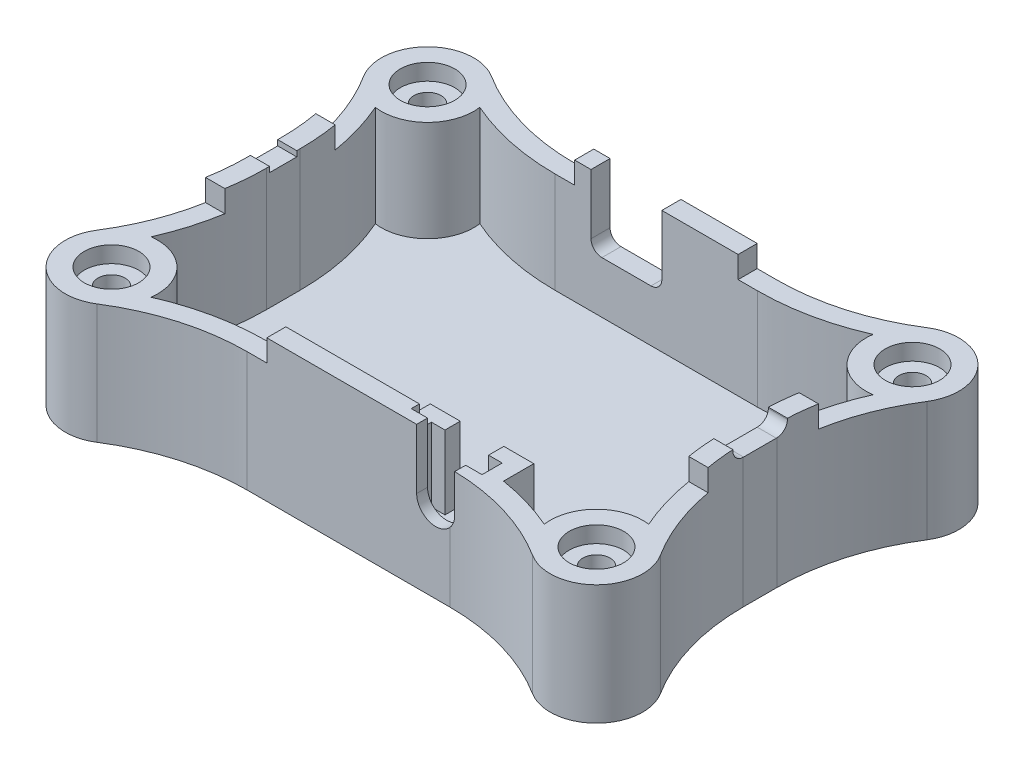
from build123d import *
from build123d.topology import SkipClean

# Parameters (mm, degrees)
SKETCH1_W                = 83
SKETCH1_H                = 52
SKETCH1_R                = 1.6
BOSS_EXTRUDE1_DEPTH      = 1.8
BOSS_EXTRUDE2_DEPTH      = 22
BOSS_EXTRUDE2_DEPTH_BACK = 15
SKETCH2_W                = 91
SKETCH2_H                = 60
SKETCH3_R                = 8.5
BOSS_EXTRUDE3_DEPTH      = 37
FILLET3_R                = 40
SHELL1_START             = -18.5
SHELL1_DEPTH             = 30
BOSS_EXTRUDE5_REACH      = 76.728
SKETCH5_R                = 5.25
CUT_EXTRUDE1_DEPTH       = 3.5
SKETCH6_R                = 2.5
CUT_EXTRUDE2_DEPTH       = 74.058195981
SPLIT1_SURFACE_1_BACK    = 136.019
SPLIT1_SURFACE_1_DEPTH   = 272.038
SPLIT1_SURFACE_2_BACK    = 136.019
SPLIT1_SURFACE_2_DEPTH   = 272.038
BOSS_EXTRUDE6_REACH      = 70.551
SKETCH8_R                = 8.5
SKETCH8_R_2              = 2.5
SKETCH9_W                = 30
SKETCH9_H                = 3.5
BOSS_EXTRUDE7_DEPTH      = 4
SKETCH11_R               = 8.5
SKETCH11_R_2             = 2.5
BOSS_EXTRUDE8_DEPTH      = 13.2
SKETCH12_W               = 30.4
SKETCH12_H               = 3.9
CUT_EXTRUDE4_DEPTH       = 4.2
SKETCH13_R               = 2.6
CUT_EXTRUDE5_DEPTH       = 10
SKETCH14_R               = 4.6
SKETCH14_R_2             = 2.6
EXTRUDE_THIN1_DEPTH      = 3.5
SKETCH15_R               = 5.5
CUT_EXTRUDE6_DEPTH       = 4
SKETCH16_R               = 2.5
BOSS_EXTRUDE9_DEPTH      = 2
BOSS_EXTRUDE10_START     = -18.5
SKETCH17_R               = 8.5
SKETCH17_R_2             = 1.75
BOSS_EXTRUDE10_DEPTH     = 12.5
SKETCH18_R               = 5
CUT_EXTRUDE7_DEPTH       = 3
SKETCH19_R               = 2.5
BOSS_EXTRUDE11_DEPTH     = 2.5
CUT_EXTRUDE8_DEPTH       = 10
SKETCH22_W               = 12.4
SKETCH22_H               = 7.750475245
BOSS_EXTRUDE12_DEPTH     = 3.5
CUT_EXTRUDE9_DEPTH       = 10
CUT_EXTRUDE9_DEPTH_BACK  = 10
CUT_EXTRUDE10_DEPTH      = 10
CUT_EXTRUDE10_DEPTH_BACK = 10
SKETCH26_W               = 5
SKETCH26_H               = 8
CUT_EXTRUDE11_DEPTH      = 10
BOSS_EXTRUDE15_REACH     = 70.551
CUT_EXTRUDE14_DEPTH      = 10
CUT_EXTRUDE14_DEPTH_BACK = 10
BOSS_EXTRUDE16_START     = -5
SKETCH34_W               = 19
SKETCH34_H               = 5
BOSS_EXTRUDE16_DEPTH     = 5
BOSS_EXTRUDE17_DEPTH     = 3.5
CUT_EXTRUDE15_DEPTH      = 1.5
MOVE_FACE1_BY            = 1.3
MOVE_FACE1_2_BY          = 1.3
SKETCH37_W               = 4
SKETCH37_H               = 12
SKETCH37_R               = 1
SKETCH37_H_2             = 15
BOSS_EXTRUDE18_DEPTH     = 5
MOVE_FACE2_BY            = 3
SKETCH38_W               = 8
SKETCH38_H               = 12
BOSS_EXTRUDE19_DEPTH     = 2
MOVE_FACE3_BY            = 0.3
MOVE_FACE3_2_BY          = 0.3
MOVE_FACE3_3_BY          = 0.3
MOVE_FACE3_4_BY          = 0.3
MOVE_FACE3_5_BY          = 0.3
MOVE_FACE3_6_BY          = 0.3
MOVE_FACE3_7_BY          = 0.3
MOVE_FACE3_8_BY          = 0.3
MOVE_FACE3_9_BY          = 0.3
MOVE_FACE3_10_BY         = 0.3
SKETCH39_R               = 1
CUT_EXTRUDE16_DEPTH      = 78.325610301


# Read off the part's stored shape, not the designer's step: Shell1
with BuildPart() as part:
    # Sketch1 → Boss-Extrude1 (new body)
    with BuildSketch(Plane(origin=(0, 0, 0), x_dir=(1, 0, 0), z_dir=(0, 1, 0))):
        Rectangle(SKETCH1_W, SKETCH1_H)
        with Locations(Location((-38.5, 23, 0), (0, 0, 270))):
            Circle(SKETCH1_R, mode=Mode.SUBTRACT)
        with Locations(Location((-38.5, -23, 0), (0, 0, 270))):
            Circle(SKETCH1_R, mode=Mode.SUBTRACT)
        with Locations(Location((38.5, -23, 0), (0, 0, 270))):
            Circle(SKETCH1_R, mode=Mode.SUBTRACT)
        with Locations(Location((38.5, 23, 0), (0, 0, 270))):
            Circle(SKETCH1_R, mode=Mode.SUBTRACT)
    extrude(amount=BOSS_EXTRUDE1_DEPTH)


with BuildPart() as body_2:
    # Sketch2 → Boss-Extrude2 (new, two sides: drawn at the far end of the back side and taken through both)
    with BuildSketch(Plane.XZ.offset(-BOSS_EXTRUDE2_DEPTH_BACK)):
        Rectangle(SKETCH2_W, SKETCH2_H)
    extrude(amount=BOSS_EXTRUDE2_DEPTH + BOSS_EXTRUDE2_DEPTH_BACK)

    # Sketch3 → Boss-Extrude3 (add, through all)
    with BuildSketch(Plane.XZ.offset(22)):
        with Locations((-44.5, 29)):
            Circle(SKETCH3_R)
        with Locations((-44.5, -29)):
            Circle(SKETCH3_R)
        with Locations((44.5, -29)):
            Circle(SKETCH3_R)
        with Locations((44.5, 29)):
            Circle(SKETCH3_R)
    extrude(amount=-BOSS_EXTRUDE3_DEPTH)

    # Fillet3
    fillet3_edges = [body_2.edges().sort_by_distance(p)[0] for p in [
        (36.059028492, -3.5, 30),
        (45.5, -3.5, 20.559028492),
        (45.5, -3.5, -20.559028492),
        (36.059028492, -3.5, -30),
        (-45.5, -3.5, -20.559028492),
        (-36.059028492, -3.5, -30),
        (-45.5, -3.5, 20.559028492),
        (-36.059028492, -3.5, 30),
    ]]
    fillet(fillet3_edges, radius=FILLET3_R)

    # Shell1 outline → Shell1 (cut)
    with BuildSketch(Plane(origin=(0, 0, 0), x_dir=(1, 0, 0), z_dir=(0, 1, 0)).offset(SHELL1_START)):
        with BuildLine():
            ThreePointArc((-48.726804124, 26.329021359), (-43.715529077, 15.187291147), (-42, 3.091507184))
            Line((-42, 3.091507184), (-42, -3.091507184))
            ThreePointArc((-42, -3.091507184), (-43.715529077, -15.187291147), (-48.726804124, -26.329021359))
            ThreePointArc((-48.726804124, -26.329021359), (-48.035533906, -32.535533906), (-41.829021359, -33.226804124))
            ThreePointArc((-41.829021359, -33.226804124), (-30.687291147, -28.215529077), (-18.591507184, -26.5))
            Line((-18.591507184, -26.5), (18.591507184, -26.5))
            ThreePointArc((18.591507184, -26.5), (30.687291147, -28.215529077), (41.829021359, -33.226804124))
            ThreePointArc((41.829021359, -33.226804124), (48.035533906, -32.535533906), (48.726804124, -26.329021359))
            ThreePointArc((48.726804124, -26.329021359), (43.715529077, -15.187291147), (42, -3.091507184))
            Line((42, -3.091507184), (42, 3.091507184))
            ThreePointArc((42, 3.091507184), (43.715529077, 15.187291147), (48.726804124, 26.329021359))
            ThreePointArc((48.726804124, 26.329021359), (48.035533906, 32.535533906), (41.829021359, 33.226804124))
            ThreePointArc((41.829021359, 33.226804124), (30.687291147, 28.215529077), (18.591507184, 26.5))
            Line((18.591507184, 26.5), (-18.591507184, 26.5))
            ThreePointArc((-18.591507184, 26.5), (-30.687291147, 28.215529077), (-41.829021359, 33.226804124))
            ThreePointArc((-41.829021359, 33.226804124), (-48.035533906, 32.535533906), (-48.726804124, 26.329021359))
        make_face()
    extrude(amount=SHELL1_DEPTH, mode=Mode.SUBTRACT)

    # Sketch4 → Boss-Extrude5 (add, up to next)
    with BuildSketch(Plane.XZ.offset(22), mode=Mode.PRIVATE) as boss_extrude5_sk1:
        with BuildLine():
            Line((-42, 26.5), (-38.5, 26.5))
            ThreePointArc((-38.5, 26.5), (-38.001095149, 28.880686376), (-38.41227904, 31.278081104))
            ThreePointArc((-38.41227904, 31.278081104), (-40.142687647, 32.213803834), (-41.829021359, 33.226804124))
            ThreePointArc((-41.829021359, 33.226804124), (-48.035533906, 32.535533906), (-48.726804124, 26.329021359))
            ThreePointArc((-48.726804124, 26.329021359), (-47.713803834, 24.642687647), (-46.778081104, 22.91227904))
            ThreePointArc((-46.778081104, 22.91227904), (-44.380686376, 22.501095149), (-42, 23))
            Line((-42, 23), (-42, 26.5))
        make_face()
    boss_extrude5_tool1 = extrude(boss_extrude5_sk1.sketch, amount=-BOSS_EXTRUDE5_REACH, mode=Mode.PRIVATE) - body_2.part
    # Sketch4 → Boss-Extrude5 (add, up to next)
    with BuildSketch(Plane.XZ.offset(22), mode=Mode.PRIVATE) as boss_extrude5_sk2:
        with BuildLine():
            Line((42, 26.5), (42, 23))
            ThreePointArc((42, 23), (44.380686376, 22.501095149), (46.778081104, 22.91227904))
            ThreePointArc((46.778081104, 22.91227904), (47.713803834, 24.642687647), (48.726804124, 26.329021359))
            ThreePointArc((48.726804124, 26.329021359), (48.035533906, 32.535533906), (41.829021359, 33.226804124))
            ThreePointArc((41.829021359, 33.226804124), (40.142687647, 32.213803834), (38.41227904, 31.278081104))
            ThreePointArc((38.41227904, 31.278081104), (38.001095149, 28.880686376), (38.5, 26.5))
            Line((38.5, 26.5), (42, 26.5))
        make_face()
    boss_extrude5_tool2 = extrude(boss_extrude5_sk2.sketch, amount=-BOSS_EXTRUDE5_REACH, mode=Mode.PRIVATE) - body_2.part
    # Sketch4 → Boss-Extrude5 (add, up to next)
    with BuildSketch(Plane.XZ.offset(22), mode=Mode.PRIVATE) as boss_extrude5_sk3:
        with BuildLine():
            Line((42, -26.5), (38.5, -26.5))
            ThreePointArc((38.5, -26.5), (38.001095149, -28.880686376), (38.41227904, -31.278081104))
            ThreePointArc((38.41227904, -31.278081104), (40.142687647, -32.213803834), (41.829021359, -33.226804124))
            ThreePointArc((41.829021359, -33.226804124), (48.035533906, -32.535533906), (48.726804124, -26.329021359))
            ThreePointArc((48.726804124, -26.329021359), (47.713803834, -24.642687647), (46.778081104, -22.91227904))
            ThreePointArc((46.778081104, -22.91227904), (44.380686376, -22.501095149), (42, -23))
            Line((42, -23), (42, -26.5))
        make_face()
    boss_extrude5_tool3 = extrude(boss_extrude5_sk3.sketch, amount=-BOSS_EXTRUDE5_REACH, mode=Mode.PRIVATE) - body_2.part
    # Sketch4 → Boss-Extrude5 (add, up to next)
    with BuildSketch(Plane.XZ.offset(22), mode=Mode.PRIVATE) as boss_extrude5_sk4:
        with BuildLine():
            Line((-42, -26.5), (-42, -23))
            ThreePointArc((-42, -23), (-44.380686376, -22.501095149), (-46.778081104, -22.91227904))
            ThreePointArc((-46.778081104, -22.91227904), (-47.713803834, -24.642687647), (-48.726804124, -26.329021359))
            ThreePointArc((-48.726804124, -26.329021359), (-48.035533906, -32.535533906), (-41.829021359, -33.226804124))
            ThreePointArc((-41.829021359, -33.226804124), (-40.142687647, -32.213803834), (-38.41227904, -31.278081104))
            ThreePointArc((-38.41227904, -31.278081104), (-38.001095149, -28.880686376), (-38.5, -26.5))
            Line((-38.5, -26.5), (-42, -26.5))
        make_face()
    boss_extrude5_tool4 = extrude(boss_extrude5_sk4.sketch, amount=-BOSS_EXTRUDE5_REACH, mode=Mode.PRIVATE) - body_2.part
    add(boss_extrude5_tool1.solids().sort_by_distance((-44.094641, -22, 28.594641))[0])
    add(boss_extrude5_tool2.solids().sort_by_distance((44.094641, -22, 28.594641))[0])
    add(boss_extrude5_tool3.solids().sort_by_distance((44.094641, -22, -28.594641))[0])
    add(boss_extrude5_tool4.solids().sort_by_distance((-44.094641, -22, -28.594641))[0])

    # Sketch5 → Cut-Extrude1 (cut)
    with BuildSketch(Plane(origin=(0, 15, 0), x_dir=(1, 0, 0), z_dir=(0, 1, 0))):
        with Locations(Location((-44.5, 29, 0), (0, 0, 270))):
            Circle(SKETCH5_R)
        with Locations(Location((-44.5, -29, 0), (0, 0, 270))):
            Circle(SKETCH5_R)
        with Locations(Location((44.5, -29, 0), (0, 0, 270))):
            Circle(SKETCH5_R)
        with Locations(Location((44.5, 29, 0), (0, 0, 270))):
            Circle(SKETCH5_R)
    extrude(amount=-CUT_EXTRUDE1_DEPTH, mode=Mode.SUBTRACT)

    # Sketch6 → Cut-Extrude2 (cut, through all)
    with BuildSketch(Plane(origin=(0, 11.5, 0), x_dir=(1, 0, 0), z_dir=(0, 1, 0))):
        with Locations(Location((-44.5, 29, 0), (0, 0, 270))):
            Circle(SKETCH6_R)
        with Locations(Location((44.5, 29, 0), (0, 0, 270))):
            Circle(SKETCH6_R)
        with Locations(Location((44.5, -29, 0), (0, 0, 270))):
            Circle(SKETCH6_R)
        with Locations(Location((-44.5, -29, 0), (0, 0, 270))):
            Circle(SKETCH6_R)
    extrude(amount=-CUT_EXTRUDE2_DEPTH, mode=Mode.SUBTRACT)


with BuildPart() as body_3:
    # Split1: the piece behind the surface
    add(body_2.part)
    # Split1 surface: a surface, the sketch's curves swept straight by 272.038 mm
    with BuildLine(Plane.XY.offset(-SPLIT1_SURFACE_1_BACK), mode=Mode.PRIVATE) as split1_surface_1_path:
        Line((-58.349277312, 0), (64.597636754, 0))
    split1_surface_1 = Shell.extrude(split1_surface_1_path.wire(), (0 * SPLIT1_SURFACE_1_DEPTH, 0 * SPLIT1_SURFACE_1_DEPTH, 1 * SPLIT1_SURFACE_1_DEPTH))
    split(bisect_by=split1_surface_1, keep=Keep.BOTTOM)

    # Sketch8 → Boss-Extrude6 (add, up to next)
    with BuildSketch(Plane.XZ, mode=Mode.PRIVATE) as boss_extrude6_sk1:
        with Locations((-44.5, 29)):
            Circle(SKETCH8_R)
        with Locations(Location((-44.5, 29, 0), (0, 0, 90))):
            Circle(SKETCH8_R_2, mode=Mode.SUBTRACT)
    boss_extrude6_tool1 = extrude(boss_extrude6_sk1.sketch, amount=BOSS_EXTRUDE6_REACH, mode=Mode.PRIVATE) - body_3.part
    # Sketch8 → Boss-Extrude6 (add, up to next)
    with BuildSketch(Plane.XZ, mode=Mode.PRIVATE) as boss_extrude6_sk2:
        with Locations((-44.5, -29)):
            Circle(SKETCH8_R)
        with Locations(Location((-44.5, -29, 0), (0, 0, 90))):
            Circle(SKETCH8_R_2, mode=Mode.SUBTRACT)
    boss_extrude6_tool2 = extrude(boss_extrude6_sk2.sketch, amount=BOSS_EXTRUDE6_REACH, mode=Mode.PRIVATE) - body_3.part
    # Sketch8 → Boss-Extrude6 (add, up to next)
    with BuildSketch(Plane.XZ, mode=Mode.PRIVATE) as boss_extrude6_sk3:
        with Locations((44.5, -29)):
            Circle(SKETCH8_R)
        with Locations(Location((44.5, -29, 0), (0, 0, 90))):
            Circle(SKETCH8_R_2, mode=Mode.SUBTRACT)
    boss_extrude6_tool3 = extrude(boss_extrude6_sk3.sketch, amount=BOSS_EXTRUDE6_REACH, mode=Mode.PRIVATE) - body_3.part
    # Sketch8 → Boss-Extrude6 (add, up to next)
    with BuildSketch(Plane.XZ, mode=Mode.PRIVATE) as boss_extrude6_sk4:
        with Locations((44.5, 29)):
            Circle(SKETCH8_R)
        with Locations(Location((44.5, 29, 0), (0, 0, 90))):
            Circle(SKETCH8_R_2, mode=Mode.SUBTRACT)
    boss_extrude6_tool4 = extrude(boss_extrude6_sk4.sketch, amount=BOSS_EXTRUDE6_REACH, mode=Mode.PRIVATE) - body_3.part
    add(boss_extrude6_tool1.solids().sort_by_distance((-52.759584, 0, 29))[0])
    add(boss_extrude6_tool2.solids().sort_by_distance((-52.759584, 0, -29))[0])
    add(boss_extrude6_tool3.solids().sort_by_distance((36.240416, 0, -29))[0])
    add(boss_extrude6_tool4.solids().sort_by_distance((36.240416, 0, 29))[0])

    # Sketch9 → Boss-Extrude7 (add)
    with BuildSketch(Plane(origin=(0, 0, 0), x_dir=(1, 0, 0), z_dir=(0, 1, 0))):
        with BuildLine():
            Line((42, -3.091507184), (42, 3.091507184))
            ThreePointArc((42, 3.091507184), (42.143265372, 6.619050584), (42.572117813, 10.12335836))
            Line((42.572117813, 10.12335836), (46.124329837, 10.131152007))
            ThreePointArc((46.124329837, 10.131152007), (45.656388175, 6.625145075), (45.5, 3.091507184))
            Line((45.5, 3.091507184), (45.5, -3.091507184))
            ThreePointArc((45.5, -3.091507184), (45.656388175, -6.625145075), (46.124329837, -10.131152007))
            Line((46.124329837, -10.131152007), (42.573395187, -10.131152007))
            ThreePointArc((42.573395187, -10.131152007), (42.143585772, -6.622986381), (42, -3.091507184))
        make_face()
        with Locations((0, -28.25)):
            Rectangle(SKETCH9_W, SKETCH9_H)
        with Locations((0, 28.25)):
            Rectangle(SKETCH9_W, SKETCH9_H)
        with BuildLine():
            Line((-45.5, 3.091507184), (-45.5, -3.091507184))
            ThreePointArc((-45.5, -3.091507184), (-45.656388175, -6.625145075), (-46.124329837, -10.131152007))
            Line((-46.124329837, -10.131152007), (-42.573395187, -10.131152007))
            ThreePointArc((-42.573395187, -10.131152007), (-42.143585772, -6.622986381), (-42, -3.091507184))
            Line((-42, -3.091507184), (-42, 3.091507184))
            ThreePointArc((-42, 3.091507184), (-42.143265372, 6.619050584), (-42.572117813, 10.12335836))
            Line((-42.572117813, 10.12335836), (-46.122937273, 10.12335836))
            ThreePointArc((-46.122937273, 10.12335836), (-45.656038669, 6.621201994), (-45.5, 3.091507184))
        make_face()
    extrude(amount=BOSS_EXTRUDE7_DEPTH)

    # Sketch13 → Cut-Extrude5 (cut)
    with BuildSketch(Plane.XZ.offset(22)):
        with Locations(Location((-27.5, 20, 0), (0, 0, 270))):
            Circle(SKETCH13_R)
        with Locations(Location((-15.5, 20, 0), (0, 0, 270))):
            Circle(SKETCH13_R)
        with Locations(Location((-3.5, 20, 0), (0, 0, 270))):
            Circle(SKETCH13_R)
    extrude(amount=-CUT_EXTRUDE5_DEPTH, mode=Mode.SUBTRACT)

    # Sketch14 → Extrude-Thin1 (add)
    # profile 1 of 3: a face of its own
    with SkipClean():  # the faces are left unmerged after this step: merging them gives an invalid solid
        with BuildSketch(Plane(origin=(0, -18.5, 0), x_dir=(1, 0, 0), z_dir=(0, 1, 0))):
            with Locations((-3.5, -20)):
                Circle(SKETCH14_R)
            with Locations((-3.5, -20)):
                Circle(SKETCH14_R_2, mode=Mode.SUBTRACT)
        # profile 2 of 3: a face of its own
        with BuildSketch(Plane(origin=(0, -18.5, 0), x_dir=(1, 0, 0), z_dir=(0, 1, 0))):
            with Locations((-15.5, -20)):
                Circle(SKETCH14_R)
            with Locations((-15.5, -20)):
                Circle(SKETCH14_R_2, mode=Mode.SUBTRACT)
        # profile 3 of 3: a face of its own
        with BuildSketch(Plane(origin=(0, -18.5, 0), x_dir=(1, 0, 0), z_dir=(0, 1, 0))):
            with Locations((-27.5, -20)):
                Circle(SKETCH14_R)
            with Locations((-27.5, -20)):
                Circle(SKETCH14_R_2, mode=Mode.SUBTRACT)
        extrude(amount=EXTRUDE_THIN1_DEPTH)

    # Sketch16 → Boss-Extrude9 (add)
    with SkipClean():  # the faces are left unmerged after this step: merging them gives an invalid solid
        with BuildSketch(Plane.XZ.offset(22)):
            with Locations(Location((-44.5, 29, 0), (0, 0, 270))):
                Circle(SKETCH16_R)
            with Locations(Location((44.5, 29, 0), (0, 0, 270))):
                Circle(SKETCH16_R)
            with Locations(Location((44.5, -29, 0), (0, 0, 270))):
                Circle(SKETCH16_R)
            with Locations(Location((-44.5, -29, 0), (0, 0, 270))):
                Circle(SKETCH16_R)
        extrude(amount=-BOSS_EXTRUDE9_DEPTH)

    # Sketch17 → Boss-Extrude10 (add)
    # profile 1 of 4: a face of its own
    with SkipClean():  # the faces are left unmerged after this step: merging them gives an invalid solid
        with BuildSketch(Plane(origin=(0, 0, 0), x_dir=(1, 0, 0), z_dir=(0, 1, 0)).offset(BOSS_EXTRUDE10_START)):
            with Locations((44.5, -29)):
                Circle(SKETCH17_R)
            with Locations(Location((44.5, -29, 0), (0, 0, 270))):
                Circle(SKETCH17_R_2, mode=Mode.SUBTRACT)
        # profile 2 of 4: a face of its own
        with BuildSketch(Plane(origin=(0, 0, 0), x_dir=(1, 0, 0), z_dir=(0, 1, 0)).offset(BOSS_EXTRUDE10_START)):
            with Locations((-44.5, -29)):
                Circle(SKETCH17_R)
            with Locations(Location((-44.5, -29, 0), (0, 0, 270))):
                Circle(SKETCH17_R_2, mode=Mode.SUBTRACT)
        # profile 3 of 4: a face of its own
        with BuildSketch(Plane(origin=(0, 0, 0), x_dir=(1, 0, 0), z_dir=(0, 1, 0)).offset(BOSS_EXTRUDE10_START)):
            with Locations((44.5, 29)):
                Circle(SKETCH17_R)
            with Locations(Location((44.5, 29, 0), (0, 0, 270))):
                Circle(SKETCH17_R_2, mode=Mode.SUBTRACT)
        # profile 4 of 4: a face of its own
        with BuildSketch(Plane(origin=(0, 0, 0), x_dir=(1, 0, 0), z_dir=(0, 1, 0)).offset(BOSS_EXTRUDE10_START)):
            with Locations((-44.5, 29)):
                Circle(SKETCH17_R)
            with Locations(Location((-44.5, 29, 0), (0, 0, 270))):
                Circle(SKETCH17_R_2, mode=Mode.SUBTRACT)
        extrude(amount=BOSS_EXTRUDE10_DEPTH)

    # Sketch18 → Cut-Extrude7 (cut)
    with SkipClean():  # the faces are left unmerged after this step: merging them gives an invalid solid
        with BuildSketch(Plane(origin=(0, 0, 0), x_dir=(1, 0, 0), z_dir=(0, 1, 0))):
            with Locations(Location((-44.5, 29, 0), (0, 0, 270))):
                Circle(SKETCH18_R)
            with Locations(Location((44.5, 29, 0), (0, 0, 270))):
                Circle(SKETCH18_R)
            with Locations(Location((44.5, -29, 0), (0, 0, 270))):
                Circle(SKETCH18_R)
            with Locations(Location((-44.5, -29, 0), (0, 0, 270))):
                Circle(SKETCH18_R)
        extrude(amount=-CUT_EXTRUDE7_DEPTH, mode=Mode.SUBTRACT)

    # Sketch21 → Cut-Extrude8 (cut)
    with SkipClean():  # the faces are left unmerged after this step: merging them gives an invalid solid
        with BuildSketch(Plane(origin=(0, 0, -30), x_dir=(-1, 0, 0), z_dir=(0, 0, -1))):
            with BuildLine():
                Line((10, -9), (1, -9))
                ThreePointArc((1, -9), (-0.414213562, -8.414213562), (-1, -7))
                Line((-1, -7), (-1, 11.444048231))
                Line((-1, 11.444048231), (12, 11.444048231))
                Line((12, 11.444048231), (12, -7))
                ThreePointArc((12, -7), (11.414213562, -8.414213562), (10, -9))
            make_face()
        extrude(amount=-CUT_EXTRUDE8_DEPTH, mode=Mode.SUBTRACT)

    # Sketch24 → Cut-Extrude10 (cut, two sides: drawn at the far end of the back side and taken through both)
    with SkipClean():  # the faces are left unmerged after this step: merging them gives an invalid solid
        with BuildSketch(Plane(origin=(45.5, 0, 0), x_dir=(0, 0, -1), z_dir=(1, 0, 0)).offset(-CUT_EXTRUDE10_DEPTH_BACK)):
            with BuildLine():
                Line((-5, 12.265132081), (5, 12.265132081))
                Line((5, 12.265132081), (5, 3.8))
                ThreePointArc((5, 3.8), (4.414213562, 2.385786438), (3, 1.8))
                Line((3, 1.8), (-3, 1.8))
                ThreePointArc((-3, 1.8), (-4.414213562, 2.385786438), (-5, 3.8))
                Line((-5, 3.8), (-5, 12.265132081))
            make_face()
        extrude(amount=CUT_EXTRUDE10_DEPTH + CUT_EXTRUDE10_DEPTH_BACK, mode=Mode.SUBTRACT)


with BuildPart() as body_2_1:
    add(body_2.part)

    # Split1: split by a surface, the side it looks to stays
    # Split1 surface: a surface, the sketch's curves swept straight by 272.038 mm
    with BuildLine(Plane.XY.offset(-SPLIT1_SURFACE_2_BACK), mode=Mode.PRIVATE) as split1_surface_2_path:
        Line((-58.349277312, 0), (64.597636754, 0))
    split1_surface_2 = Shell.extrude(split1_surface_2_path.wire(), (0 * SPLIT1_SURFACE_2_DEPTH, 0 * SPLIT1_SURFACE_2_DEPTH, 1 * SPLIT1_SURFACE_2_DEPTH))
    split(bisect_by=split1_surface_2, keep=Keep.TOP)

    # Sketch11 → Boss-Extrude8 (add)
    # profile 1 of 4: a face of its own
    with BuildSketch(Plane(origin=(0, 1.8, 0), x_dir=(1, 0, 0), z_dir=(0, 1, 0))):
        with Locations((-44.5, -29)):
            Circle(SKETCH11_R)
        with Locations(Location((-44.5, -29, 0), (0, 0, 270))):
            Circle(SKETCH11_R_2, mode=Mode.SUBTRACT)
    # profile 2 of 4: a face of its own
    with BuildSketch(Plane(origin=(0, 1.8, 0), x_dir=(1, 0, 0), z_dir=(0, 1, 0))):
        with Locations((44.5, -29)):
            Circle(SKETCH11_R)
        with Locations(Location((44.5, -29, 0), (0, 0, 270))):
            Circle(SKETCH11_R_2, mode=Mode.SUBTRACT)
    # profile 3 of 4: a face of its own
    with BuildSketch(Plane(origin=(0, 1.8, 0), x_dir=(1, 0, 0), z_dir=(0, 1, 0))):
        with Locations((44.5, 29)):
            Circle(SKETCH11_R)
        with Locations(Location((44.5, 29, 0), (0, 0, 270))):
            Circle(SKETCH11_R_2, mode=Mode.SUBTRACT)
    # profile 4 of 4: a face of its own
    with BuildSketch(Plane(origin=(0, 1.8, 0), x_dir=(1, 0, 0), z_dir=(0, 1, 0))):
        with Locations((-44.5, 29)):
            Circle(SKETCH11_R)
        with Locations(Location((-44.5, 29, 0), (0, 0, 270))):
            Circle(SKETCH11_R_2, mode=Mode.SUBTRACT)
    extrude(amount=BOSS_EXTRUDE8_DEPTH)

    # Sketch12 → Cut-Extrude4 (cut)
    with BuildSketch(Plane.XZ):
        with BuildLine():
            Line((-45.7, 3.091507184), (-45.7, -3.091507184))
            ThreePointArc((-45.7, -3.091507184), (-45.865982535, -6.722575837), (-46.362545707, -10.32335836))
            Line((-46.362545707, -10.32335836), (-42.402548468, -10.32335836))
            ThreePointArc((-42.402548468, -10.32335836), (-41.950897644, -6.719961955), (-41.8, -3.091507184))
            Line((-41.8, -3.091507184), (-41.8, 3.091507184))
            ThreePointArc((-41.8, 3.091507184), (-41.951225908, 6.72389966), (-42.403856984, 10.331152007))
            Line((-42.403856984, 10.331152007), (-46.363986626, 10.331152007))
            ThreePointArc((-46.363986626, 10.331152007), (-45.866344275, 6.726522156), (-45.7, 3.091507184))
        make_face()
        with Locations((0, 28.25)):
            Rectangle(SKETCH12_W, SKETCH12_H)
        with BuildLine():
            Line((41.8, 3.091507184), (41.8, -3.091507184))
            ThreePointArc((41.8, -3.091507184), (41.950881998, -6.71977416), (42.402486098, -10.322986665))
            Line((42.402486098, -10.322986665), (46.364084026, -10.331678515))
            ThreePointArc((46.364084026, -10.331678515), (45.866368727, -6.726788758), (45.7, -3.091507184))
            Line((45.7, -3.091507184), (45.7, 3.091507184))
            ThreePointArc((45.7, 3.091507184), (45.866344275, 6.726522156), (46.363986626, 10.331152007))
            Line((46.363986626, 10.331152007), (42.403856984, 10.331152007))
            ThreePointArc((42.403856984, 10.331152007), (41.951225908, 6.72389966), (41.8, 3.091507184))
        make_face()
        with Locations((0, -28.25)):
            Rectangle(SKETCH12_W, SKETCH12_H)
    extrude(amount=-CUT_EXTRUDE4_DEPTH, mode=Mode.SUBTRACT)

    # Sketch15 → Cut-Extrude6 (cut)
    with BuildSketch(Plane.XZ.offset(-15)):
        with Locations(Location((-44.5, 29, 0), (0, 0, 270))):
            Circle(SKETCH15_R)
        with Locations(Location((44.5, 29, 0), (0, 0, 270))):
            Circle(SKETCH15_R)
        with Locations(Location((44.5, -29, 0), (0, 0, 270))):
            Circle(SKETCH15_R)
        with Locations(Location((-44.5, -29, 0), (0, 0, 270))):
            Circle(SKETCH15_R)
    extrude(amount=CUT_EXTRUDE6_DEPTH, mode=Mode.SUBTRACT)

    # Sketch19 → Boss-Extrude11 (add)
    # profile 1 of 4: a face of its own
    with BuildSketch(Plane.XZ):
        with BuildLine():
            Line((-42, 26.5), (-40.638653085, 26.5))
            ThreePointArc((-40.638653085, 26.5), (-47.752691193, 32.252691193), (-42, 25.138653085))
            Line((-42, 25.138653085), (-42, 26.5))
        make_face()
        with Locations(Location((-44.5, 29, 0), (0, 0, 90))):
            Circle(SKETCH19_R, mode=Mode.SUBTRACT)
    # profile 2 of 4: a face of its own
    with BuildSketch(Plane.XZ):
        with BuildLine():
            Line((-42, -26.5), (-42, -25.138653085))
            ThreePointArc((-42, -25.138653085), (-47.752691193, -32.252691193), (-40.638653085, -26.5))
            Line((-40.638653085, -26.5), (-42, -26.5))
        make_face()
        with Locations(Location((-44.5, -29, 0), (0, 0, 90))):
            Circle(SKETCH19_R, mode=Mode.SUBTRACT)
    # profile 3 of 4: a face of its own
    with BuildSketch(Plane.XZ):
        with BuildLine():
            Line((42, -26.5), (42, -25.138653085))
            ThreePointArc((42, -25.138653085), (47.752691193, -32.252691193), (40.638653085, -26.5))
            Line((40.638653085, -26.5), (42, -26.5))
        make_face()
        with Locations(Location((44.5, -29, 0), (0, 0, 90))):
            Circle(SKETCH19_R, mode=Mode.SUBTRACT)
    # profile 4 of 4: a face of its own
    with BuildSketch(Plane.XZ):
        with BuildLine():
            Line((42, 26.5), (42, 25.138653085))
            ThreePointArc((42, 25.138653085), (47.752691193, 32.252691193), (40.638653085, 26.5))
            Line((40.638653085, 26.5), (42, 26.5))
        make_face()
        with Locations(Location((44.5, 29, 0), (0, 0, 90))):
            Circle(SKETCH19_R, mode=Mode.SUBTRACT)
    extrude(amount=BOSS_EXTRUDE11_DEPTH)

    # Sketch22 → Boss-Extrude12 (add)
    with BuildSketch(Plane(origin=(0, 0, -30), x_dir=(-1, 0, 0), z_dir=(0, 0, -1))):
        with Locations((5.5, 3.875237623)):
            Rectangle(SKETCH22_W, SKETCH22_H)
    extrude(amount=-BOSS_EXTRUDE12_DEPTH)

    # Sketch23 → Cut-Extrude9 (cut, two sides: drawn at the far end of the back side and taken through both)
    with BuildSketch(Plane(origin=(45.5, 0, 0), x_dir=(0, 0, -1), z_dir=(1, 0, 0)).offset(-CUT_EXTRUDE9_DEPTH_BACK)):
        with BuildLine():
            Line((5, 6), (5, 2.865427762))
            ThreePointArc((5, 2.865427762), (0, -2.134572238), (-5, 2.865427762))
            Line((-5, 2.865427762), (-5, 6))
            ThreePointArc((-5, 6), (0, 11), (5, 6))
        make_face()
    extrude(amount=CUT_EXTRUDE9_DEPTH + CUT_EXTRUDE9_DEPTH_BACK, mode=Mode.SUBTRACT)


with BuildPart() as cut_extrude11_tool:
    # Sketch26 → Cut-Extrude11 (new body)
    with SkipClean():  # the faces are left unmerged after this step: merging them gives an invalid solid
        with BuildSketch(Plane.ZY.offset(45.5)):
            with Locations((0, 7)):
                Rectangle(SKETCH26_W, SKETCH26_H)
        extrude(amount=-CUT_EXTRUDE11_DEPTH)


with BuildPart() as body_2_2:
    with SkipClean():  # the faces are left unmerged after this step: merging them gives an invalid solid
        add(body_2_1.part)

        # Cut-Extrude11: cut by cut_extrude11_tool
        add(cut_extrude11_tool.part, mode=Mode.SUBTRACT)

    # Sketch35 → Boss-Extrude17 (add)
    with BuildSketch(Plane.XY.offset(30)):
        with BuildLine():
            Line((12.7, 5.652887373), (19.3, 5.652887373))
            Line((19.3, 5.652887373), (19.3, -5.833809621))
            ThreePointArc((19.3, -5.833809621), (16, -3.5), (12.7, -5.833809621))
            Line((12.7, -5.833809621), (12.7, 5.652887373))
        make_face()
    extrude(amount=-BOSS_EXTRUDE17_DEPTH)


with BuildPart() as body_3_1:
    with SkipClean():  # the faces are left unmerged after this step: merging them gives an invalid solid
        add(body_3.part)

        # Cut-Extrude11: cut by cut_extrude11_tool
        add(cut_extrude11_tool.part, mode=Mode.SUBTRACT)

    # Sketch32 → Boss-Extrude15 (add, up to next)
    with BuildSketch(Plane(origin=(0, 0, 0), x_dir=(1, 0, 0), z_dir=(0, 1, 0)), mode=Mode.PRIVATE) as boss_extrude15_sk1:
        Polygon((12, -23), (9.5, -23), (9.5, -26.5), (22.5, -26.5), (22.5, -23), (20, -23), (20, -21.5), (25.5, -21.5), (25.5, -30), (6.5, -30), (6.5, -21.5), (12, -21.5), align=None)
    boss_extrude15_tool1 = extrude(boss_extrude15_sk1.sketch, amount=-BOSS_EXTRUDE15_REACH, mode=Mode.PRIVATE) - body_3_1.part
    add(boss_extrude15_tool1.solids().sort_by_distance((16, 0, 26.591346))[0])
    add(boss_extrude15_tool1.solids().sort_by_distance((16, 0, 26.591346))[1])

    # Sketch33 → Cut-Extrude14 (cut, two sides: drawn at the far end of the back side and taken through both)
    with SkipClean():  # the faces are left unmerged after this step: merging them gives an invalid solid
        with BuildSketch(Plane.XY.offset(30).offset(-CUT_EXTRUDE14_DEPTH_BACK)):
            with BuildLine():
                Line((19.5, 9.004083488), (19.5, -7))
                ThreePointArc((19.5, -7), (16, -10.5), (12.5, -7))
                Line((12.5, -7), (12.5, 9.004083488))
                ThreePointArc((12.5, 9.004083488), (16, 12.504083488), (19.5, 9.004083488))
            make_face()
        extrude(amount=CUT_EXTRUDE14_DEPTH + CUT_EXTRUDE14_DEPTH_BACK, mode=Mode.SUBTRACT)

    # Sketch34 → Boss-Extrude16 (add)
    with SkipClean():  # the faces are left unmerged after this step: merging them gives an invalid solid
        with BuildSketch(Plane(origin=(0, 0, 21.5), x_dir=(-1, 0, 0), z_dir=(0, 0, -1)).offset(BOSS_EXTRUDE16_START)):
            with Locations((-16, -16)):
                Rectangle(SKETCH34_W, SKETCH34_H)
        extrude(amount=BOSS_EXTRUDE16_DEPTH)


with BuildPart() as cut_extrude15_tool:
    # Sketch36 → Cut-Extrude15 (new body)
    with SkipClean():  # the faces are left unmerged after this step: merging them gives an invalid solid
        with BuildSketch(Plane(origin=(0, 0, 26.5), x_dir=(-1, 0, 0), z_dir=(0, 0, -1))):
            Polygon((-9.5, -13.5), (-22.5, -13.5), (-22.5, 0), (-12.5, 0), (-12.5, 4), (-9.5, 4), (-9.5, 0), align=None)
        extrude(amount=-CUT_EXTRUDE15_DEPTH)


with BuildPart() as body_2_3:
    with SkipClean():  # the faces are left unmerged after this step: merging them gives an invalid solid
        add(body_2_2.part)

        # Cut-Extrude15: cut by cut_extrude15_tool
        add(cut_extrude15_tool.part, mode=Mode.SUBTRACT)

    # Sketch37 → Boss-Extrude18 (add)
    # profile 1 of 3: a face of its own
    with BuildSketch(Plane(origin=(0, 15, 0), x_dir=(1, 0, 0), z_dir=(0, 1, 0))):
        with Locations((6, -13)):
            Rectangle(SKETCH37_W, SKETCH37_H)
        with Locations((6, -12)):
            Circle(SKETCH37_R, mode=Mode.SUBTRACT)
    # profile 2 of 3: a face of its own
    with BuildSketch(Plane(origin=(0, 15, 0), x_dir=(1, 0, 0), z_dir=(0, 1, 0))):
        with Locations((-6, -13)):
            Rectangle(SKETCH37_W, SKETCH37_H)
        with Locations((-6, -12)):
            Circle(SKETCH37_R, mode=Mode.SUBTRACT)
    # profile 3 of 3: a face of its own
    with BuildSketch(Plane(origin=(0, 15, 0), x_dir=(1, 0, 0), z_dir=(0, 1, 0))):
        with Locations((0, 0.5)):
            Rectangle(SKETCH37_W, SKETCH37_H_2)
        with Locations((0, 4)):
            Circle(SKETCH37_R, mode=Mode.SUBTRACT)
    extrude(amount=BOSS_EXTRUDE18_DEPTH)

    # Move Face2: a face moved inward by 3.0
    extrude(body_2_3.faces().sort_by_distance((0, 20, -0.306614803))[0], amount=MOVE_FACE2_BY, dir=(0, -1, 0), mode=Mode.SUBTRACT)

    # Sketch38 → Boss-Extrude19 (add)
    with BuildSketch(Plane(origin=(0, 17, 0), x_dir=(1, 0, 0), z_dir=(0, 1, 0))):
        with Locations((0, -13)):
            Rectangle(SKETCH38_W, SKETCH38_H)
    extrude(amount=-BOSS_EXTRUDE19_DEPTH)

    # Move Face3: a face moved inward by 0.3
    extrude(body_2_3.faces().sort_by_distance((0, 16.25, 19))[0], amount=MOVE_FACE3_BY, dir=(0, 0, -1), mode=Mode.SUBTRACT)

    # Move Face3 2: a face moved inward by 0.3
    extrude(body_2_3.faces().sort_by_distance((-8, 17.5, 13))[0], amount=MOVE_FACE3_2_BY, dir=(1, 0, 0), mode=Mode.SUBTRACT)

    # Move Face3 3: a face moved inward by 0.3
    extrude(body_2_3.faces().sort_by_distance((-4, 18.5, 13))[0], amount=MOVE_FACE3_3_BY, dir=(-1, 0, 0), mode=Mode.SUBTRACT)

    # Move Face3 4: a face moved inward by 0.3
    extrude(body_2_3.faces().sort_by_distance((8, 17.5, 13))[0], amount=MOVE_FACE3_4_BY, dir=(-1, 0, 0), mode=Mode.SUBTRACT)

    # Move Face3 5: a face moved inward by 0.3
    extrude(body_2_3.faces().sort_by_distance((4, 18.5, 13))[0], amount=MOVE_FACE3_5_BY, dir=(1, 0, 0), mode=Mode.SUBTRACT)

    # Move Face3 6: a face moved inward by 0.3
    extrude(body_2_3.faces().sort_by_distance((5.5, 17.25, 7))[0], amount=MOVE_FACE3_6_BY, dir=(0, 0, 1), mode=Mode.SUBTRACT)

    # Move Face3 7: a face moved inward by 0.3
    extrude(body_2_3.faces().sort_by_distance((-5.5, 17.25, 7))[0], amount=MOVE_FACE3_7_BY, dir=(0, 0, 1), mode=Mode.SUBTRACT)

    # Move Face3 8: a face moved inward by 0.3
    extrude(body_2_3.faces().sort_by_distance((-2, 16, -0.5))[0], amount=MOVE_FACE3_8_BY, dir=(1, 0, 0), mode=Mode.SUBTRACT)

    # Move Face3 9: a face moved inward by 0.3
    extrude(body_2_3.faces().sort_by_distance((2, 16, -0.5))[0], amount=MOVE_FACE3_9_BY, dir=(-1, 0, 0), mode=Mode.SUBTRACT)

    # Move Face3 10: a face moved inward by 0.3
    extrude(body_2_3.faces().sort_by_distance((0, 16, -8))[0], amount=MOVE_FACE3_10_BY, dir=(0, 0, 1), mode=Mode.SUBTRACT)

    # Sketch39 → Cut-Extrude16 (cut, through all)
    with BuildSketch(Plane(origin=(0, 20, 0), x_dir=(1, 0, 0), z_dir=(0, 1, 0))):
        with Locations((-6, -12)):
            Circle(SKETCH39_R)
        with Locations((6, -12)):
            Circle(SKETCH39_R)
        with Locations((0, 4)):
            Circle(SKETCH39_R)
    extrude(amount=-CUT_EXTRUDE16_DEPTH, mode=Mode.SUBTRACT)


with BuildPart() as body_3_2:
    with SkipClean():  # the faces are left unmerged after this step: merging them gives an invalid solid
        add(body_3_1.part)

        # Cut-Extrude15: cut by cut_extrude15_tool
        add(cut_extrude15_tool.part, mode=Mode.SUBTRACT)

    # Move Face1: a face moved outward by 1.3
    extrude(body_3_2.faces().sort_by_distance((21.25, -6.75, 23))[0], amount=MOVE_FACE1_BY, dir=(0, 0, 1))

    # Move Face1 2: a face moved outward by 1.3
    extrude(body_3_2.faces().sort_by_distance((10.75, -6.75, 23))[0], amount=MOVE_FACE1_2_BY, dir=(0, 0, 1))


solid = body_3_2.part
